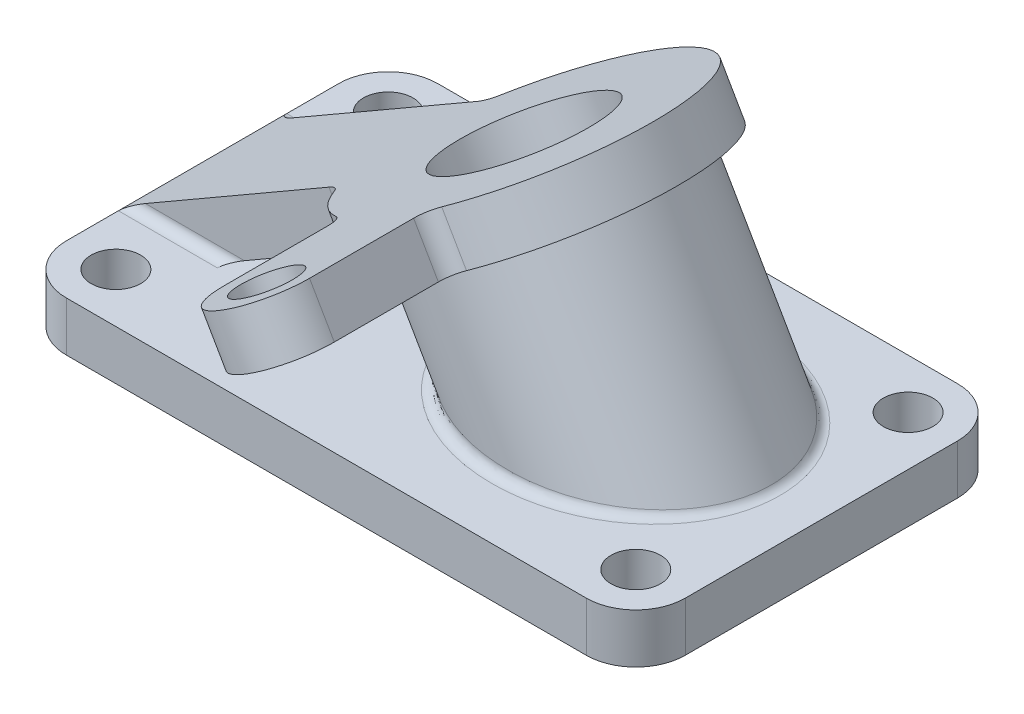
from build123d import *

# Parameters (mm, degrees)
SKETCH_1_R          = 5
EXTRUDE_1_DEPTH     = 10
CUT_EXTRUDE_1_DEPTH = 4
SKETCH_4_R          = 15
SKETCH_4_R_2        = 6
EXTRUDE_2_DEPTH     = 10
EXTRUDE_7_REACH     = 107.748
SKETCH_6_R          = 25
SKETCH_13_R         = 15
CUT_EXTRUDE_2_DEPTH = 109.800134443
FILLET_7_R          = 2
FILLET_8_R          = 2
FILLET_9_R          = 2
FILLET_10_R         = 1


with BuildPart() as part:
    # 草图1 → 凸台-拉伸1 (new body)
    with BuildSketch(Plane(origin=(0, 0, 0), x_dir=(1, 0, 0), z_dir=(0, 1, 0))):
        with BuildLine():
            Line((-52.5, 37.5), (52.5, 37.5))
            ThreePointArc((52.5, 37.5), (59.571067812, 34.571067812), (62.5, 27.5))
            Line((62.5, 27.5), (62.5, -27.5))
            ThreePointArc((62.5, -27.5), (59.571067812, -34.571067812), (52.5, -37.5))
            Line((52.5, -37.5), (-52.5, -37.5))
            ThreePointArc((-52.5, -37.5), (-59.571067812, -34.571067812), (-62.5, -27.5))
            Line((-62.5, -27.5), (-62.5, 27.5))
            ThreePointArc((-62.5, 27.5), (-59.571067812, 34.571067812), (-52.5, 37.5))
        make_face()
        with Locations(Location((-52.5, -27.5, 0), (0, 0, 270))):
            Circle(SKETCH_1_R, mode=Mode.SUBTRACT)
        with Locations(Location((52.5, -27.5, 0), (0, 0, 270))):
            Circle(SKETCH_1_R, mode=Mode.SUBTRACT)
        with Locations(Location((52.5, 27.5, 0), (0, 0, 270))):
            Circle(SKETCH_1_R, mode=Mode.SUBTRACT)
        with Locations(Location((-52.5, 27.5, 0), (0, 0, 270))):
            Circle(SKETCH_1_R, mode=Mode.SUBTRACT)
    extrude(amount=EXTRUDE_1_DEPTH)

    # 草图5 → 切除-拉伸1 (cut)
    with BuildSketch(Plane.XZ):
        with BuildLine():
            Line((40.5, 27.5), (-40.5, 27.5))
            ThreePointArc((-40.5, 27.5), (-44.014718626, 19.014718626), (-52.5, 15.5))
            Line((-52.5, 15.5), (-52.5, -15.5))
            ThreePointArc((-52.5, -15.5), (-44.014718626, -19.014718626), (-40.5, -27.5))
            Line((-40.5, -27.5), (40.5, -27.5))
            ThreePointArc((40.5, -27.5), (44.014718626, -19.014718626), (52.5, -15.5))
            Line((52.5, -15.5), (52.5, 15.5))
            ThreePointArc((52.5, 15.5), (44.014718626, 19.014718626), (40.5, 27.5))
        make_face()
    extrude(amount=-CUT_EXTRUDE_1_DEPTH, mode=Mode.SUBTRACT)

    # 草图4 → 凸台-拉伸2 (add)
    with BuildSketch(Plane(origin=(-19.955127019, 34.563293868, 0), x_dir=(0, 0, 1), z_dir=(-0.500000000000001, 0.866025403784438, 0))):
        with BuildLine():
            Line((30.98386677, 35.873412263), (52, 35.873412263))
            ThreePointArc((52, 35.873412263), (62, 25.873412263), (52, 15.873412263))
            Line((52, 15.873412263), (30.98386677, 15.873412263))
            ThreePointArc((30.98386677, 15.873412263), (28.814562191, 15.234084465), (27.338705973, 13.520471087))
            ThreePointArc((27.338705973, 13.520471087), (22.923803215, 6.52142926), (16.764705882, 0.994814299))
            ThreePointArc((16.764705882, 0.994814299), (15.468627995, -0.443659223), (15, -2.322332096))
            Line((15, -2.322332096), (15, -49.126587737))
            Line((15, -49.126587737), (-15, -49.126587737))
            Line((-15, -49.126587737), (-15, -2.322332096))
            ThreePointArc((-15, -2.322332096), (-15.468627995, -0.443659223), (-16.764705882, 0.994814299))
            ThreePointArc((-16.764705882, 0.994814299), (-19.351983004, 48.797215478), (27.338705973, 38.22635344))
            ThreePointArc((27.338705973, 38.22635344), (28.814562191, 36.512740062), (30.98386677, 35.873412263))
        make_face()
        with Locations(Location((0, 25.873412263, 0), (0, 0, 270))):
            Circle(SKETCH_4_R, mode=Mode.SUBTRACT)
        with Locations(Location((52, 25.873412263, 0), (0, 0, 270))):
            Circle(SKETCH_4_R_2, mode=Mode.SUBTRACT)
    extrude(amount=-EXTRUDE_2_DEPTH)

    # 凸台-拉伸7: up to this plane
    extrude_7_end = Plane(origin=(-52.5, 10, 27.5), z_dir=(0, 1, 0))
    # 草图6 → 凸台-拉伸7 (add, up to the surface)
    with BuildSketch(Plane(origin=(-14.955127019, 25.90303983, 0), x_dir=(0.8660254037844382, 0.500000000000001, 0), z_dir=(0.500000000000001, -0.8660254037844382, 0)), mode=Mode.PRIVATE) as extrude_7_sk1:
        with Locations(Location((25.873412263, 0, 0), (0, 0, 180))):
            Circle(SKETCH_6_R)
    extrude_7_tool1 = split(extrude(extrude_7_sk1.sketch, amount=EXTRUDE_7_REACH, mode=Mode.PRIVATE), bisect_by=extrude_7_end, keep=Keep.BOTH, mode=Mode.PRIVATE)
    add(extrude_7_tool1.solids().sort_by_distance((7.451905, 38.839746, 0))[0])

    # 草图13 → 切除-拉伸2 (cut, through all)
    with BuildSketch(Plane(origin=(-19.955127019, 34.563293868, 0), x_dir=(0, 0, 1), z_dir=(-0.500000000000001, 0.866025403784438, 0))):
        with Locations(Location((0, 25.873412263, 0), (0, 0, 270))):
            Circle(SKETCH_13_R)
    extrude(amount=-CUT_EXTRUDE_2_DEPTH, mode=Mode.SUBTRACT)

    # 圆角7
    fillet_7_edges = [part.edges().sort_by_distance(p)[0] for p in [
        (-52.5, 10, 15),
    ]]
    fillet(fillet_7_edges, radius=FILLET_7_R)

    # 圆角8
    # the kernel refuses this fillet: 2 mm, written as the material it adds along each edge
    with BuildSketch(Plane(origin=(-37.5, 10, -15), x_dir=(0, 0, -1), z_dir=(-1, 0, 0))) as fillet_8_piece_1_section:
        with BuildLine():
            CenterArc((FILLET_8_R, -FILLET_8_R), FILLET_8_R, 90, 90)
            Line((0, -FILLET_8_R), (0, 0))
            Line((0, 0), (FILLET_8_R, 0))
        make_face()
    fillet_8_piece_1 = extrude(amount=25, mode=Mode.PRIVATE)
    fillet_8_piece_1 = split(fillet_8_piece_1, bisect_by=Plane(origin=(-49.214592268, 6.123328347, -15.452717167), z_dir=(-0.500000000000001, 0.866025403784438, 0)), keep=Keep.TOP, mode=Mode.PRIVATE)
    fillet_8_piece_1 = split(fillet_8_piece_1, bisect_by=Plane(origin=(-54.214592268, 14.783582385, -15.452717167), z_dir=(0.500000000000001, -0.866025403784438, 0)), keep=Keep.TOP, mode=Mode.PRIVATE)
    add(fillet_8_piece_1)

    # 圆角9
    fillet_9_edges = [part.edges().sort_by_distance(p)[0] for p in [
        (52.970053814, 10, -0.001007854),
    ]]
    fillet(fillet_9_edges, radius=FILLET_9_R)

    # 圆角10
    fillet_10_edges = [part.edges().sort_by_distance(p)[0] for p in [
        (29.102540378, 51.339745962, 0),
    ]]
    fillet(fillet_10_edges, radius=FILLET_10_R)


solid = part.part
